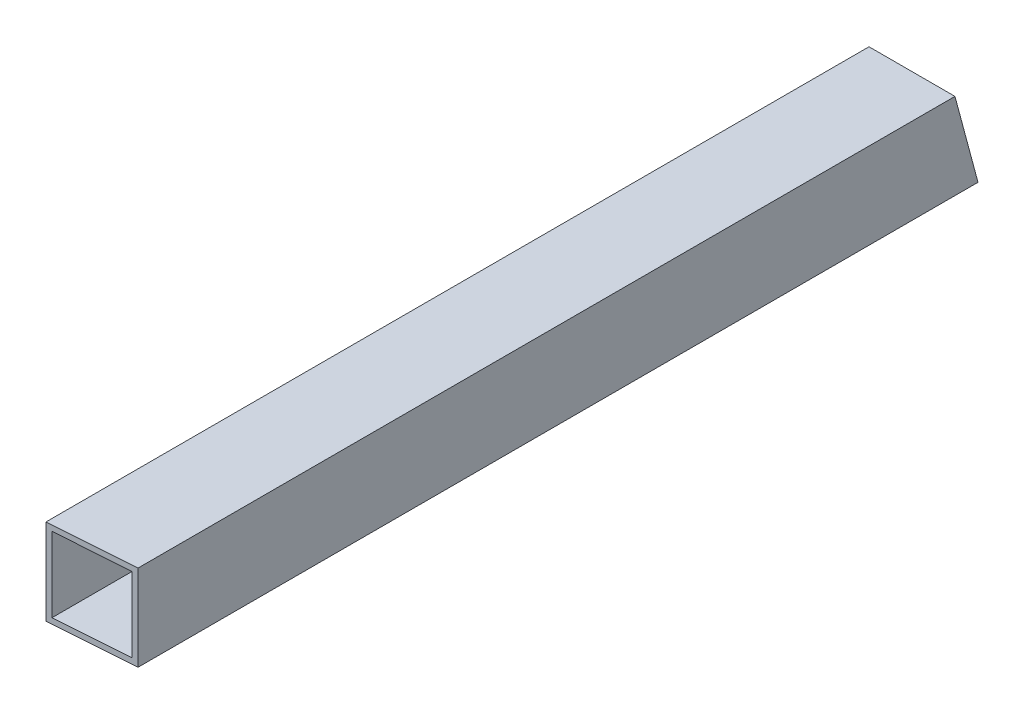
from build123d import *

# Parameters (mm, degrees)
SKETCH6_W           = 25.4
SKETCH6_H           = 25.4
BOSS_EXTRUDE1_DEPTH = 250
CUT_EXTRUDE2_DEPTH  = 253.567456336
SHELL1_T            = -1.651
CUT_EXTRUDE3_DEPTH  = 253.567456336


with BuildPart() as part:
    # Sketch6 → Boss-Extrude1 (new body)
    with BuildSketch(Plane.XY):
        with Locations((12.7, -12.7)):
            Rectangle(SKETCH6_W, SKETCH6_H)
    extrude(amount=BOSS_EXTRUDE1_DEPTH)

    # Sketch7 → Cut-Extrude2 (cut, through all)
    with BuildSketch(Plane(origin=(0, 0, 0), x_dir=(1, 0, 0), z_dir=(0, 1, 0))):
        Polygon((0, -250), (25.4, -248.180583461), (25.4, -250), align=None)
    extrude(amount=-CUT_EXTRUDE2_DEPTH, mode=Mode.SUBTRACT)

    # Shell1
    shell1_openings = [part.faces().sort_by_distance(p)[0] for p in [
        (12.7, -12.7, 249.090291731),
        (12.7, -12.7, 0),
    ]]
    offset(amount=SHELL1_T, openings=shell1_openings, kind=Kind.INTERSECTION)

    # Sketch10 → Cut-Extrude3 (cut, through all)
    with BuildSketch(Plane.ZY):
        Polygon((0, -25.4), (6.805909488, 0), (0, 0), align=None)
    extrude(amount=-CUT_EXTRUDE3_DEPTH, mode=Mode.SUBTRACT)


solid = part.part
